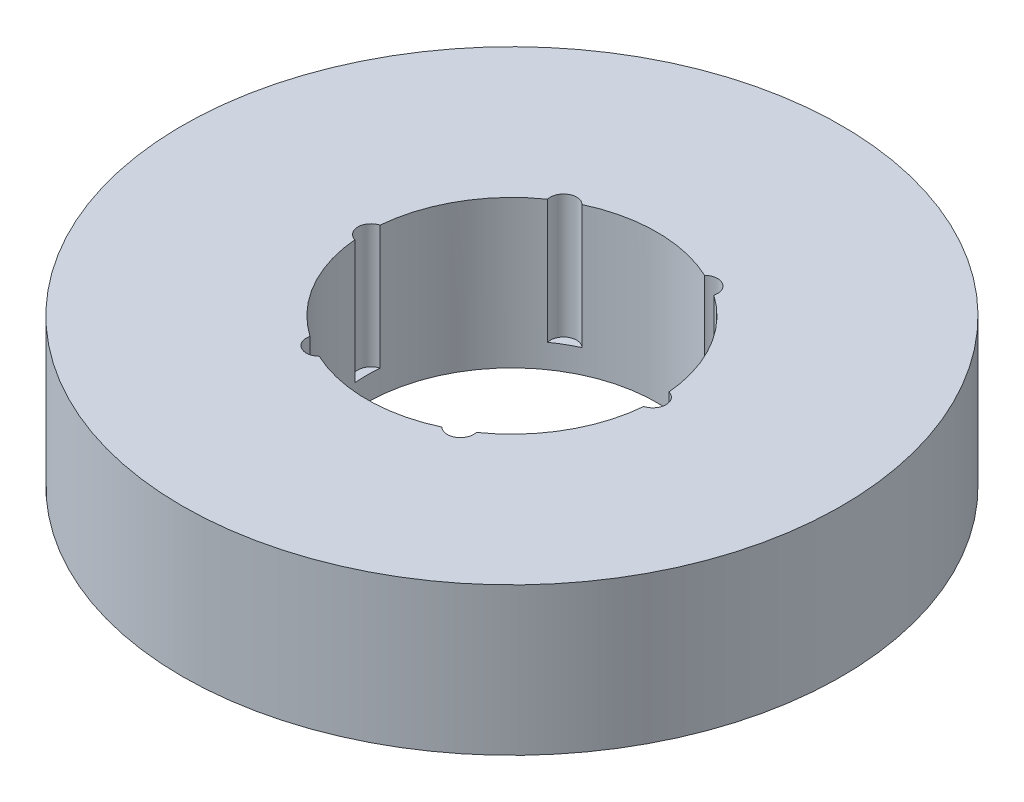
from build123d import *

# Parameters (mm, degrees)
SKETCH1_R           = 62.5
BOSS_EXTRUDE1_DEPTH = 28
SKETCH2_R           = 27.5
CUT_EXTRUDE1_DEPTH  = 93.717312299
SKETCH3_R           = 2.484551129
CUT_EXTRUDE2_DEPTH  = 23.49589667
CIRPATTERN1_COUNT   = 6


with BuildPart() as part:
    # Sketch1 → Boss-Extrude1 (new body)
    with BuildSketch(Plane(origin=(0, 0, 0), x_dir=(1, 0, 0), z_dir=(0, 1, 0))):
        Circle(SKETCH1_R)
    extrude(amount=BOSS_EXTRUDE1_DEPTH)

    # Sketch2 → Cut-Extrude1 (cut, through all)
    with BuildSketch(Plane(origin=(0, 0, 0), x_dir=(1, 0, 0), z_dir=(0, 1, 0))):
        Circle(SKETCH2_R)
    extrude(amount=CUT_EXTRUDE1_DEPTH, mode=Mode.SUBTRACT)

    # Sketch3 → Cut-Extrude2 (cut)
    with BuildSketch(Plane(origin=(0, 28, 0), x_dir=(1, 0, 0), z_dir=(0, 1, 0))):
        with Locations((-26.724120653, 0)):
            Circle(SKETCH3_R)
    cut_extrude2 = extrude(amount=-CUT_EXTRUDE2_DEPTH, mode=Mode.SUBTRACT)

    # CirPattern1: Cut-Extrude2 ×6 about axis
    cirpattern1_axis = Axis((0, 0, 0), (0, 1, 0))
    for i in range(1, CIRPATTERN1_COUNT):
        add(cut_extrude2.rotate(cirpattern1_axis, i * 360 / CIRPATTERN1_COUNT), mode=Mode.SUBTRACT)


solid = part.part
